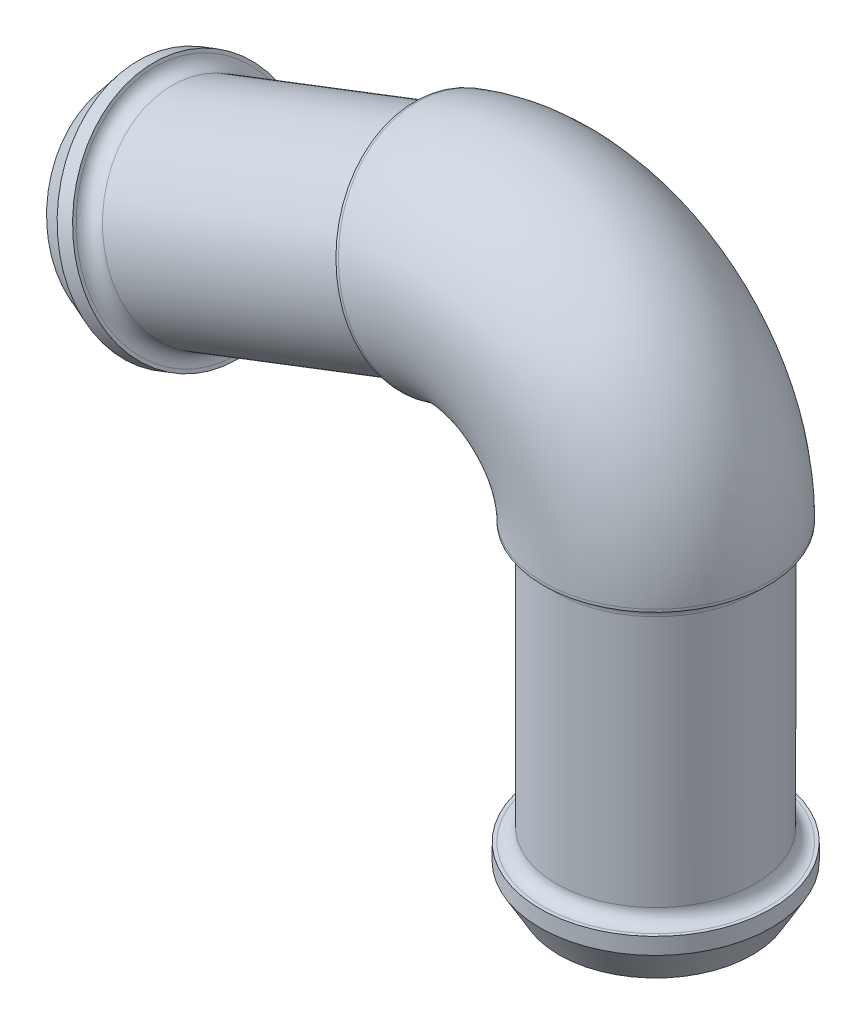
from build123d import *
from OCP.BRepFilletAPI import BRepFilletAPI_MakeChamfer

# Parameters (mm, degrees)
SWEEP1_PROFILE_R     = 9.525
SWEEP2_PROFILE_R     = 10.794999999999998
CUT_SWEEP1_PROFILE_R = 7.9375
SKETCH1_R            = 11.112499999999997
SKETCH1_R_2          = 9.524999999999995
BOSS_EXTRUDE1_DEPTH  = 4.7625
BOSS_EXTRUDE2_START  = -4.7625
SKETCH2_R            = 11.112499999999999
SKETCH2_R_2          = 9.525
BOSS_EXTRUDE2_DEPTH  = 4.7625
CHAMFER1_SIZE        = 3.175
CHAMFER1_SIZE2       = 1.8330871046770671
CHAMFER1_SIZE2_2     = 1.8330871046770665
FILLET1_R            = 1.27
FILLET2_R            = 1.27


with BuildPart() as part:
    # Sweep1: sweep along a curve in space
    with BuildLine() as sweep1_path:
        Line((0, 0, 0), (0, 31.75, 0))
        ThreePointArc((0, 31.75, 0), (-6.068684082248161, 43.28467117973109, 2.908e-14), (-19.012049192719964, 44.81661939415364, 3.295e-14))
        Line((-48.653227734006144, 33.43843699609044, -2.6e-16), (-19.012049192719964, 44.81661939415364, 3.295e-14))
    # Sweep1 profile (on start of the path) → Sweep1 (sweep)
    with BuildSketch(Plane.ZX):
        Circle(SWEEP1_PROFILE_R)
    sweep(path=sweep1_path.line)

    # Sweep2: sweep along a curve in space
    with BuildLine() as sweep2_path:
        Line((-19.249178621050255, 44.72559393496914, 3.268e-14), (-19.012049192719964, 44.81661939415364, 3.295e-14))
        ThreePointArc((0, 31.75, 0), (-6.068684082248161, 43.28467117973109, 2.908e-14), (-19.012049192719964, 44.81661939415364, 3.295e-14))
        Line((0, 31.496000000000002, 0), (0, 31.75, 0))
    # Sweep2 profile (on start of the path) → Sweep2 (sweep)
    with BuildSketch(Plane(origin=(-19.249178621050255, 44.72559393496914, 3.268e-14), x_dir=(-0.3583679495452768, 0.9335804264972108, 0), z_dir=(0.9335804264972108, 0.3583679495452768, 1.0458735957354108e-15))):
        Circle(SWEEP2_PROFILE_R)
    sweep(path=sweep2_path.line)

    # Cut-Sweep1: sweep along a curve in space
    with BuildLine() as cut_sweep1_path:
        Line((0, 0, 0), (0, 31.75, 0))
        ThreePointArc((0, 31.75, 0), (-6.068684082248161, 43.28467117973109, 2.908e-14), (-19.012049192719964, 44.81661939415364, 3.295e-14))
        Line((-48.653227734006144, 33.43843699609044, -2.6e-16), (-19.012049192719964, 44.81661939415364, 3.295e-14))
    # Cut-Sweep1 profile (on start of the path) → Cut-Sweep1 (sweep, cut)
    with BuildSketch(Plane.ZX):
        Circle(CUT_SWEEP1_PROFILE_R)
    sweep(path=cut_sweep1_path.line, mode=Mode.SUBTRACT)

    # Sketch1 → Boss-Extrude1 (add)
    with BuildSketch(Plane(origin=(-31.21747027220995, -11.983264102288556, -3.497e-14), x_dir=(3.580410510393217e-07, -9.327288296924547e-07, 0.9999999999995011), z_dir=(-0.9335804264972027, -0.3583679495452978, -1.045873613984892e-15))):
        with Locations(Location((-4.860884700071e-05, 48.65322773398188, 0), (0, 0, 270.000057244))):
            Circle(SKETCH1_R)
        with Locations(Location((-4.860884700071e-05, 48.65322773398188, 0), (0, 0, 270.000057244))):
            Circle(SKETCH1_R_2, mode=Mode.SUBTRACT)
    extrude(amount=-BOSS_EXTRUDE1_DEPTH)

    # Sketch2 → Boss-Extrude2 (add)
    with BuildSketch(Plane.XZ.offset(BOSS_EXTRUDE2_START)):
        with Locations(Location((0, 0, 0), (0, 0, 270))):
            Circle(SKETCH2_R)
        with Locations(Location((0, 0, 0), (0, 0, 90))):
            Circle(SKETCH2_R_2, mode=Mode.SUBTRACT)
    extrude(amount=BOSS_EXTRUDE2_DEPTH)

    # Chamfer1: one chamfer whose edges measure the first distance from different faces: ONE call of the kernel's chamfer builder (chamfer() names one face for all edges)
    chamfer1_edges_1 = [part.edges().sort_by_distance(p)[0] for p in [
        (-52.635591573328284, 43.81284948554062, -9.401835e-11),
    ]]
    chamfer1_side_1 = [part.faces().sort_by_distance(p)[0] for p in [
        (-50.41250318273182, 44.666213165395355, -9.401586e-11),
    ]]
    chamfer1_edges_2 = [part.edges().sort_by_distance(p)[0] for p in [
        (3.4e-15, 0, 11.112499999999999),
    ]]
    chamfer1_side_2 = [part.faces().sort_by_distance(p)[0] for p in [
        (3.4e-15, 2.38125, 11.112499999999999),
    ]]
    chamfer1 = BRepFilletAPI_MakeChamfer(part.part.solid().wrapped)
    for e in chamfer1_edges_1:
        chamfer1.Add(CHAMFER1_SIZE, CHAMFER1_SIZE2, e.wrapped, chamfer1_side_1[0].wrapped)  # the first distance lies on this face
    for e in chamfer1_edges_2:
        chamfer1.Add(CHAMFER1_SIZE, CHAMFER1_SIZE2_2, e.wrapped, chamfer1_side_2[0].wrapped)  # the first distance lies on this face
    add(Compound.cast(chamfer1.Shape()), mode=Mode.REPLACE)

    # Fillet1
    fillet1_edges = [part.edges().sort_by_distance(p)[0] for p in [
        (-44.20705095281329, 35.14516435580008, -9.525000000000015),
        (-1.75e-15, 4.7625, -9.525),
    ]]
    fillet(fillet1_edges, radius=FILLET1_R)

    # Fillet2
    fillet2_edges = [part.edges().sort_by_distance(p)[0] for p in [
        (1.17e-15, 31.496000000000002, -9.525),
        (-19.249178621050255, 44.725593934969154, -9.524999999999967),
    ]]
    fillet(fillet2_edges, radius=FILLET2_R - 0.0001)  # a hair under: the kernel refuses the full size


solid = part.part
